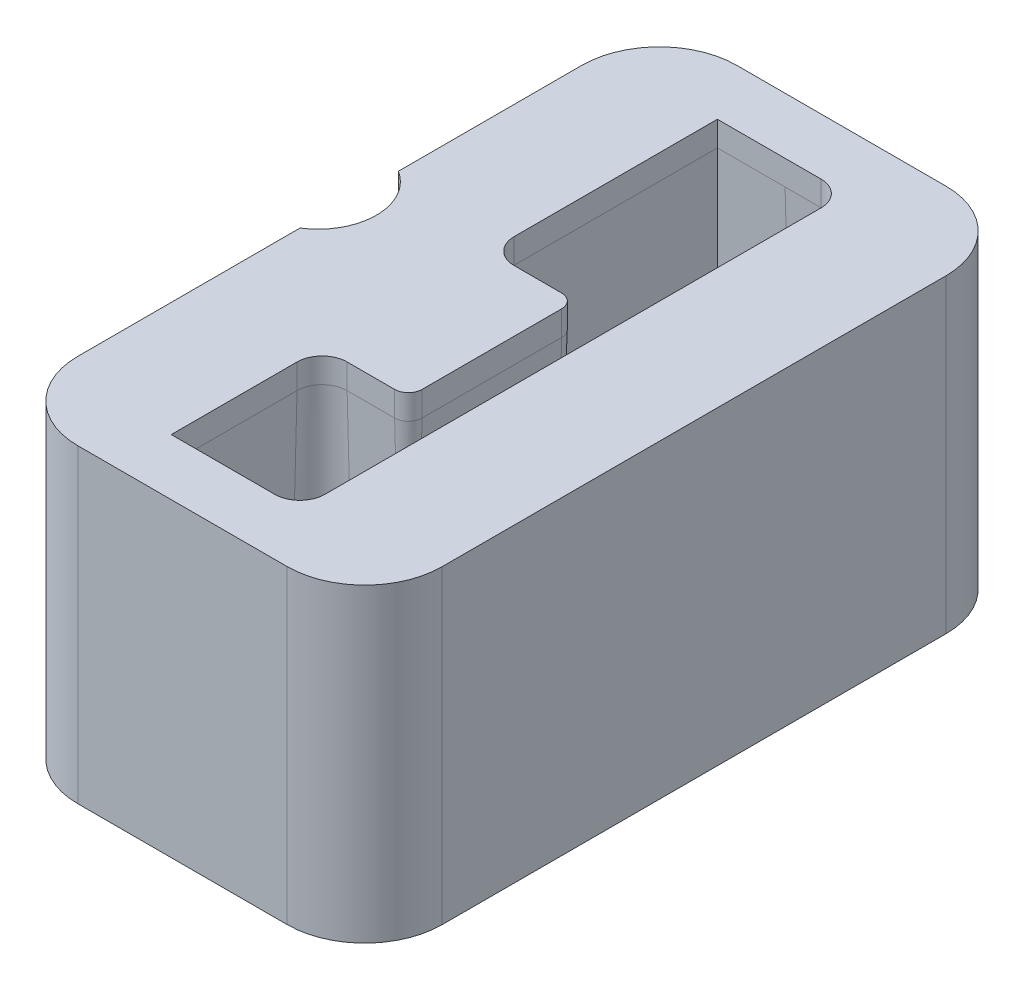
from build123d import *

# Parameters (mm, degrees)
SKETCH1_W                   = 47
SKETCH1_H                   = 85
BOSS_EXTRUDE1_DEPTH         = 40
FILLET1_R                   = 10
CUT_EXTRUDE1_REACH          = 64.917
M6_TAPPED_HOLE1_D           = 5
M6_TAPPED_HOLE1_DEPTH       = 17
M6_TAPPED_HOLE1_CSINK_D     = 6.05
M6_TAPPED_HOLE1_CSINK_ANGLE = 90
M6_TAPPED_HOLE1_TIP         = 1.502151548
SKETCH9_R                   = 7.5
CUT_EXTRUDE2_DEPTH          = 268.695101375


with BuildPart() as part:
    # Sketch1 → Boss-Extrude1 (new body)
    with BuildSketch(Plane(origin=(0, 0, 0), x_dir=(1, 0, 0), z_dir=(0, 1, 0))):
        Rectangle(SKETCH1_W, SKETCH1_H)
    extrude(amount=-BOSS_EXTRUDE1_DEPTH)

    # Fillet1
    fillet1_edges = [part.edges().sort_by_distance(p)[0] for p in [
        (-23.5, -20, -42.5),
        (23.5, -20, -42.5),
        (-23.5, -20, 42.5),
        (23.5, -20, 42.5),
    ]]
    fillet(fillet1_edges, radius=FILLET1_R)

    # Sketch3 → Cut-Extrude1 (cut, up to next)
    with BuildSketch(Plane(origin=(0, 0, 0), x_dir=(1, 0, 0), z_dir=(0, 1, 0)), mode=Mode.PRIVATE) as cut_extrude1_sk1:
        with BuildLine():
            Line((4.63, 35.23), (-8.73, 35.23))
            Line((-8.73, 35.23), (-8.73, 9))
            ThreePointArc((-8.73, 9), (-7.783954903, 6.716045097), (-5.5, 5.77))
            Line((-5.5, 5.77), (0.63, 5.77))
            ThreePointArc((0.63, 5.77), (1.881579003, 5.251579003), (2.4, 4))
            Line((2.4, 4), (2.4, -14))
            ThreePointArc((2.4, -14), (1.881579003, -15.251579003), (0.63, -15.77))
            Line((0.63, -15.77), (-5.5, -15.77))
            ThreePointArc((-5.5, -15.77), (-7.783954903, -16.716045097), (-8.73, -19))
            Line((-8.73, -19), (-8.73, -35.23))
            Line((-8.73, -35.23), (4.63, -35.23))
            ThreePointArc((4.63, -35.23), (6.913954903, -34.283954903), (7.86, -32))
            Line((7.86, -32), (7.86, 32))
            ThreePointArc((7.86, 32), (6.913954903, 34.283954903), (4.63, 35.23))
        make_face()
    cut_extrude1_tool1 = extrude(cut_extrude1_sk1.sketch, amount=-CUT_EXTRUDE1_REACH, mode=Mode.PRIVATE) & part.part
    add(cut_extrude1_tool1.solids().sort_by_distance((6.402103, 0, -33.772103))[0], mode=Mode.SUBTRACT)

    # Cut-Sweep1: sweep along a path in Sketch5
    with BuildLine(Plane(origin=(0, 0, 0), x_dir=(1, 0, 0), z_dir=(0, 1, 0))) as cut_sweep1_path:
        Line((-8.73, -35.23), (4.63, -35.23))
        ThreePointArc((4.63, -35.23), (6.913954903, -34.283954903), (7.86, -32))
        Line((7.86, -32), (7.86, 32))
        ThreePointArc((7.86, 32), (6.913954903, 34.283954903), (4.63, 35.23))
        Line((4.63, 35.23), (-8.73, 35.23))
        Line((-8.73, 35.23), (-8.73, 9))
        ThreePointArc((-8.73, 9), (-7.783954903, 6.716045097), (-5.5, 5.77))
        Line((-5.5, 5.77), (0.63, 5.77))
        ThreePointArc((0.63, 5.77), (1.881579003, 5.251579003), (2.4, 4))
        Line((2.4, 4), (2.4, -14))
        ThreePointArc((2.4, -14), (1.881579003, -15.251579003), (0.63, -15.77))
        Line((0.63, -15.77), (-5.5, -15.77))
        ThreePointArc((-5.5, -15.77), (-7.783954903, -16.716045097), (-8.73, -19))
        Line((-8.73, -19), (-8.73, -35.23))
    # Sketch4 → Cut-Sweep1 (sweep, cut)
    with BuildSketch(Plane(origin=(0, 0, 0), x_dir=(0, 0, -1), z_dir=(1, 0, 0))):
        Polygon((35.23, -3.2), (36.193641914, -40), (35.23, -40), align=None)
    sweep(path=cut_sweep1_path.line, transition=Transition.RIGHT, mode=Mode.SUBTRACT)

    # M6 Tapped Hole1
    with Locations(Plane(origin=(0, -40, 0), x_dir=(-1, 0, 0), z_dir=(0, -1, 0))):
        with Locations((-16.5, 35.5), (16.5, 35.5), (16.5, -35.5), (-16.5, -35.5)):
            CounterSinkHole(M6_TAPPED_HOLE1_D / 2, M6_TAPPED_HOLE1_CSINK_D / 2, depth=M6_TAPPED_HOLE1_DEPTH, counter_sink_angle=M6_TAPPED_HOLE1_CSINK_ANGLE)
            with Locations((0, 0, -(M6_TAPPED_HOLE1_DEPTH + M6_TAPPED_HOLE1_TIP / 2))):  # 118° drill point
                Cone(0, M6_TAPPED_HOLE1_D / 2, M6_TAPPED_HOLE1_TIP, mode=Mode.SUBTRACT)

    # Sketch9 → Cut-Extrude2 (cut, through all)
    with BuildSketch(Plane(origin=(236.38, 0, 7.73), x_dir=(1, 0, 0), z_dir=(0, 1, 0))):
        with Locations((-263.88, 10.23)):
            Circle(SKETCH9_R)
    extrude(amount=-CUT_EXTRUDE2_DEPTH, mode=Mode.SUBTRACT)


solid = part.part
